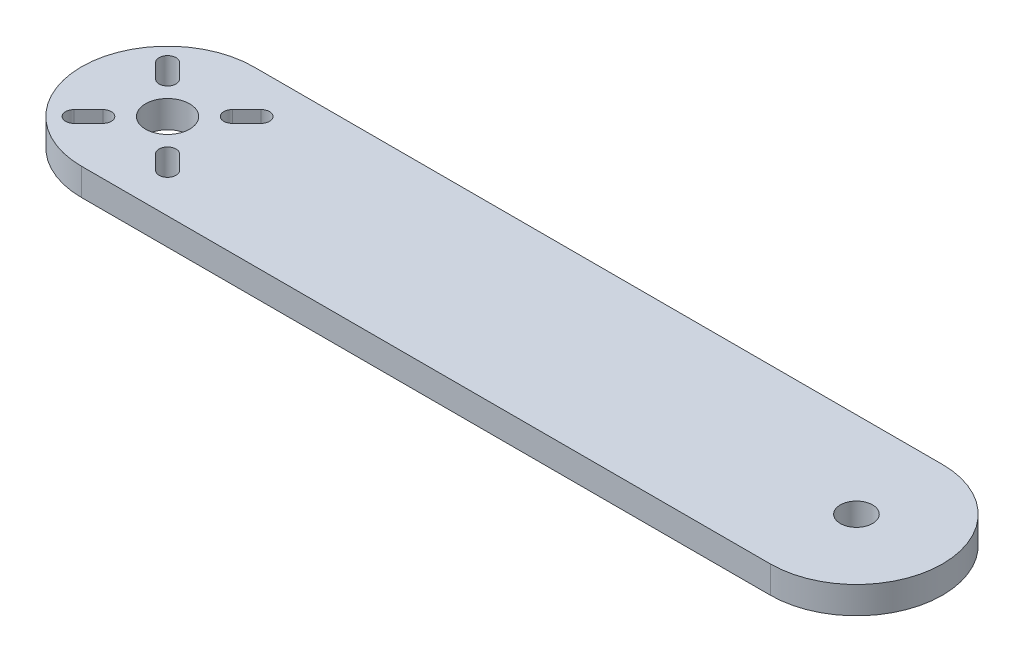
from build123d import *

# Parameters (mm, degrees)
SKETCH1_R           = 3.25
SKETCH1_R_2         = 2.38125
BOSS_EXTRUDE1_DEPTH = 4


with BuildPart() as part:
    # Sketch1 → Boss-Extrude1 (new body)
    with BuildSketch(Plane(origin=(0, 0, 0), x_dir=(1, 0, 0), z_dir=(0, 1, 0))):
        with BuildLine():
            Line((-50.8, 12.7), (50.8, 12.7))
            ThreePointArc((50.8, 12.7), (63.5, 0), (50.8, -12.7))
            Line((50.8, -12.7), (-50.8, -12.7))
            ThreePointArc((-50.8, -12.7), (-63.5, 0), (-50.8, 12.7))
        make_face()
        with Locations((-50.8, 0)):
            Circle(SKETCH1_R, mode=Mode.SUBTRACT)
        with Locations((50.8, 0)):
            Circle(SKETCH1_R_2, mode=Mode.SUBTRACT)
        with BuildLine():
            Line((-56.81040764, 7.778174593), (-54.689087297, 5.656854249))
            ThreePointArc((-54.689087297, 5.656854249), (-54.689087297, 3.889087297), (-56.456854249, 3.889087297))
            Line((-56.456854249, 3.889087297), (-58.578174593, 6.01040764))
            ThreePointArc((-58.578174593, 6.01040764), (-58.578174593, 7.778174593), (-56.81040764, 7.778174593))
        make_face(mode=Mode.SUBTRACT)
        with BuildLine():
            Line((-43.021825407, 6.01040764), (-45.143145751, 3.889087297))
            ThreePointArc((-45.143145751, 3.889087297), (-46.910912703, 3.889087297), (-46.910912703, 5.656854249))
            Line((-46.910912703, 5.656854249), (-44.78959236, 7.778174593))
            ThreePointArc((-44.78959236, 7.778174593), (-43.021825407, 7.778174593), (-43.021825407, 6.01040764))
        make_face(mode=Mode.SUBTRACT)
        with BuildLine():
            Line((-44.78959236, -7.778174593), (-46.910912703, -5.656854249))
            ThreePointArc((-46.910912703, -5.656854249), (-46.910912703, -3.889087297), (-45.143145751, -3.889087297))
            Line((-45.143145751, -3.889087297), (-43.021825407, -6.01040764))
            ThreePointArc((-43.021825407, -6.01040764), (-43.021825407, -7.778174593), (-44.78959236, -7.778174593))
        make_face(mode=Mode.SUBTRACT)
        with BuildLine():
            Line((-58.578174593, -6.01040764), (-56.456854249, -3.889087297))
            ThreePointArc((-56.456854249, -3.889087297), (-54.689087297, -3.889087297), (-54.689087297, -5.656854249))
            Line((-54.689087297, -5.656854249), (-56.81040764, -7.778174593))
            ThreePointArc((-56.81040764, -7.778174593), (-58.578174593, -7.778174593), (-58.578174593, -6.01040764))
        make_face(mode=Mode.SUBTRACT)
    extrude(amount=BOSS_EXTRUDE1_DEPTH)


solid = part.part
